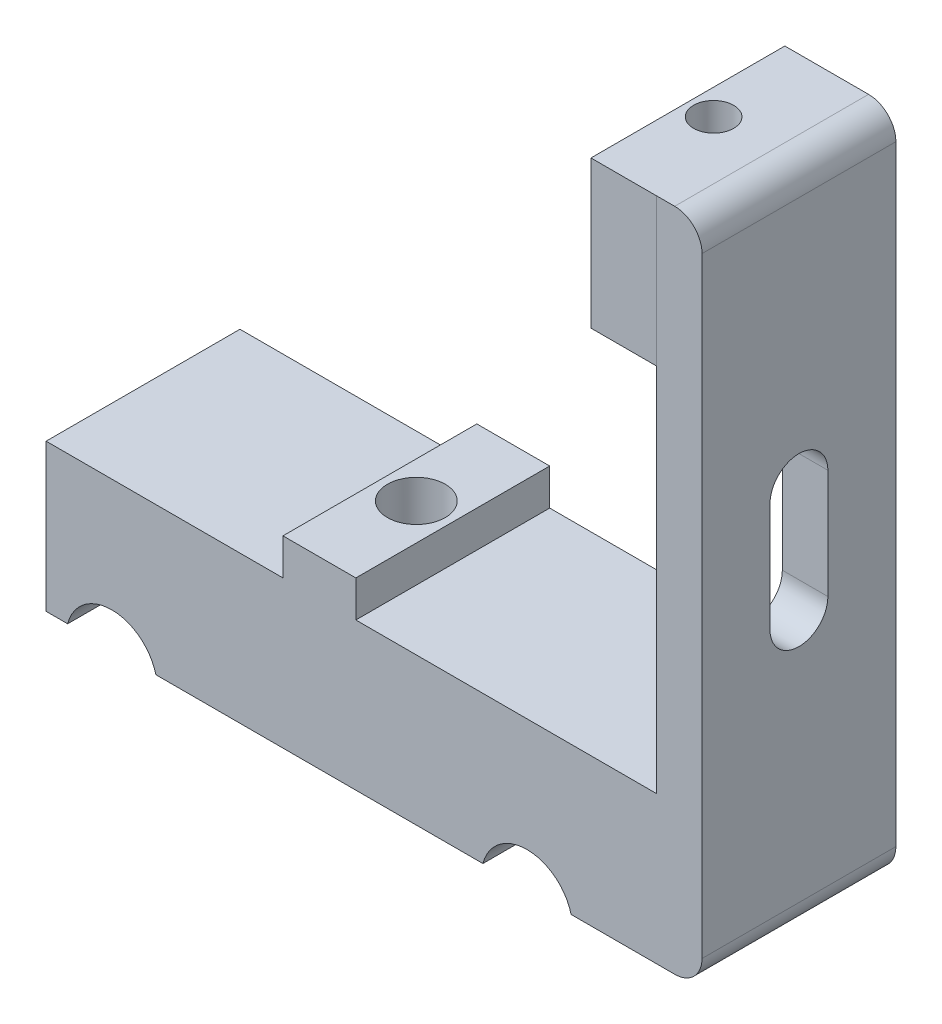
from build123d import *

# Parameters (mm, degrees)
BOSS_EXTRUDE1_DEPTH     = 10.8
BOSS_EXTRUDE2_DEPTH     = 10.64
CUT_EXTRUDE1_DEPTH      = 39.168054705
CUT_EXTRUDE1_DEPTH_BACK = 39.168054705
SKETCH5_R               = 5
FILLET1_R               = 1
SKETCH6_W               = 21.28
SKETCH6_H               = 16.18
BOSS_EXTRUDE3_DEPTH     = 12
SKETCH7_W               = 5
SKETCH7_H               = 21.281328743
BOSS_EXTRUDE4_DEPTH     = 56.83
SKETCH8_W               = 21.284331222
SKETCH8_H               = 16.18
BOSS_EXTRUDE5_DEPTH     = 7.19
FILLET3_R               = 3
SKETCH9_R               = 2.2
CUT_EXTRUDE2_DEPTH      = 85.918196519
SKETCH10_R              = 3.175
CUT_EXTRUDE3_DEPTH      = 85.918196519
SKETCH11_W              = 24.977296572
SKETCH11_H              = 9.721484234
CUT_EXTRUDE4_DEPTH      = 71.220021919
CUT_EXTRUDE5_DEPTH      = 90.46728118


with BuildPart() as part:
    # Sketch2 → Boss-Extrude1 (new body)
    with BuildSketch(Plane.XY):
        Polygon((10.1, 0), (10.1, 1.709943763), (6.25480432, 7), (-6.25480432, 7), (-10.1, 1.709943763), (-10.1, 0), align=None)
    extrude(amount=BOSS_EXTRUDE1_DEPTH)

    # Sketch4 → Boss-Extrude2 (add, symmetric)
    with BuildSketch(Plane.XY):
        Polygon((-4, 0), (-4, -4.8), (-30, -4.8), (-30, -20.98), (30, -20.98), (30, -4.8), (4, -4.8), (4, 0), align=None)
    extrude(amount=BOSS_EXTRUDE2_DEPTH, both=True)

    # Sketch5 → Cut-Extrude1 (cut, two sides: drawn at the far end of the back side and taken through both)
    with BuildSketch(Plane.XY.offset(-CUT_EXTRUDE1_DEPTH_BACK)):
        with Locations((-22.790976064, -22.227391232)):
            Circle(SKETCH5_R)
        with Locations((22.790976064, -22.227391232)):
            Circle(SKETCH5_R)
    extrude(amount=CUT_EXTRUDE1_DEPTH + CUT_EXTRUDE1_DEPTH_BACK, mode=Mode.SUBTRACT)

    # Fillet1
    fillet1_edges = [part.edges().sort_by_distance(p)[0] for p in [
        (-10.1, 0, 5.4),
        (-10.1, 1.709943763, 5.4),
        (-6.25480432, 7, 5.4),
        (6.25480432, 7, 5.4),
        (10.1, 0, 5.4),
        (10.1, 1.709943763, 5.4),
    ]]
    fillet(fillet1_edges, radius=FILLET1_R)

    # Sketch6 → Boss-Extrude3 (add)
    with BuildSketch(Plane(origin=(30, 0, 0), x_dir=(0, 0, -1), z_dir=(1, 0, 0))):
        with Locations((0, -12.89)):
            Rectangle(SKETCH6_W, SKETCH6_H)
    extrude(amount=BOSS_EXTRUDE3_DEPTH)

    # Sketch7 → Boss-Extrude4 (add)
    with BuildSketch(Plane(origin=(0, -4.8, 0), x_dir=(1, 0, 0), z_dir=(0, 1, 0))):
        with Locations((39.5, 0.000664372)):
            Rectangle(SKETCH7_W, SKETCH7_H)
    extrude(amount=BOSS_EXTRUDE4_DEPTH)

    # Sketch8 → Boss-Extrude5 (add)
    with BuildSketch(Plane.ZY.offset(-37)):
        with Locations((0.000836868, 43.94)):
            Rectangle(SKETCH8_W, SKETCH8_H)
    extrude(amount=BOSS_EXTRUDE5_DEPTH)

    # Fillet3
    fillet3_edges = [part.edges().sort_by_distance(p)[0] for p in [
        (42, 52.03, -0.000664372),
        (42, -20.98, 0),
    ]]
    fillet(fillet3_edges, radius=FILLET3_R)

    # Sketch9 → Cut-Extrude2 (cut, through all)
    with BuildSketch(Plane.XZ.offset(20.98)):
        with Locations((32.632878078, 0)):
            Circle(SKETCH9_R)
    extrude(amount=-CUT_EXTRUDE2_DEPTH, mode=Mode.SUBTRACT)

    # Sketch10 → Cut-Extrude3 (cut, through all)
    with BuildSketch(Plane.XZ.offset(20.98)):
        with Locations((0.000925951, 0)):
            Circle(SKETCH10_R)
    extrude(amount=-CUT_EXTRUDE3_DEPTH, mode=Mode.SUBTRACT)

    # Sketch11 → Cut-Extrude4 (cut, through all)
    with BuildSketch(Plane.XY.offset(10.8)):
        with Locations((-0.121132817, 4.060742117)):
            Rectangle(SKETCH11_W, SKETCH11_H)
    extrude(amount=-CUT_EXTRUDE4_DEPTH, mode=Mode.SUBTRACT)

    # Sketch12 → Cut-Extrude5 (cut, through all)
    with BuildSketch(Plane(origin=(42, 0, 0), x_dir=(0, 0, -1), z_dir=(1, 0, 0))):
        with BuildLine():
            Line((-3.175, 21.525), (-3.175, 9.525))
            ThreePointArc((-3.175, 9.525), (0, 6.35), (3.175, 9.525))
            Line((3.175, 9.525), (3.175, 21.525))
            ThreePointArc((3.175, 21.525), (0, 24.7), (-3.175, 21.525))
        make_face()
    extrude(amount=-CUT_EXTRUDE5_DEPTH, mode=Mode.SUBTRACT)


solid = part.part
